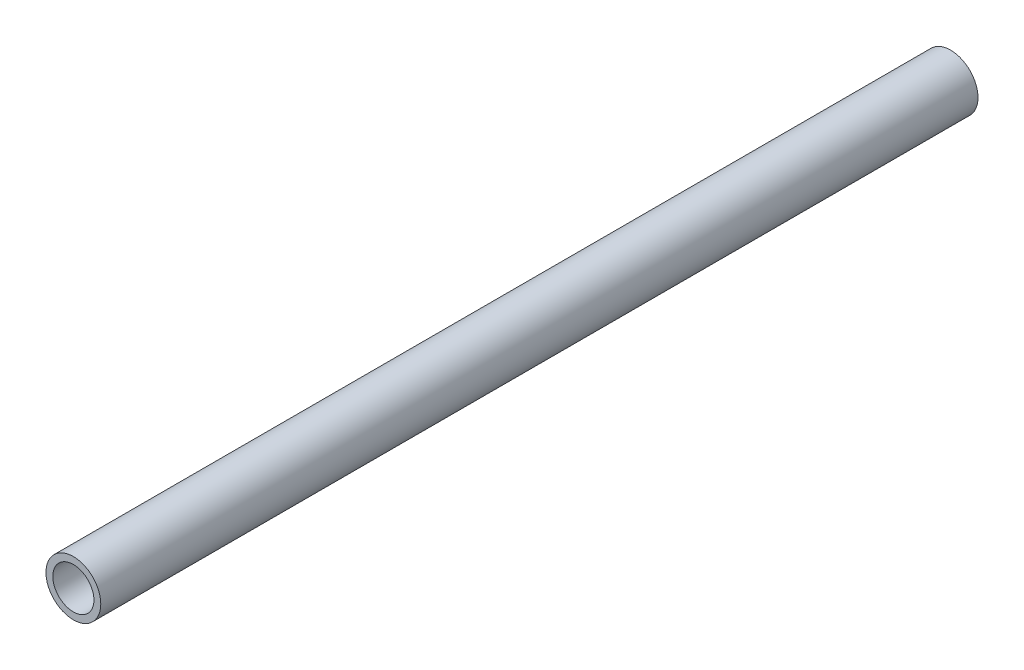
from build123d import *

# Parameters (mm, degrees)
SKETCH1_R           = 6.35
SKETCH1_R_2         = 4.7625
BOSS_EXTRUDE1_DEPTH = 101.6


with BuildPart() as part:
    # Sketch1 → Boss-Extrude1 (new, symmetric)
    with BuildSketch(Plane.XY):
        Circle(SKETCH1_R)
        Circle(SKETCH1_R_2, mode=Mode.SUBTRACT)
    extrude(amount=BOSS_EXTRUDE1_DEPTH, both=True)


solid = part.part
